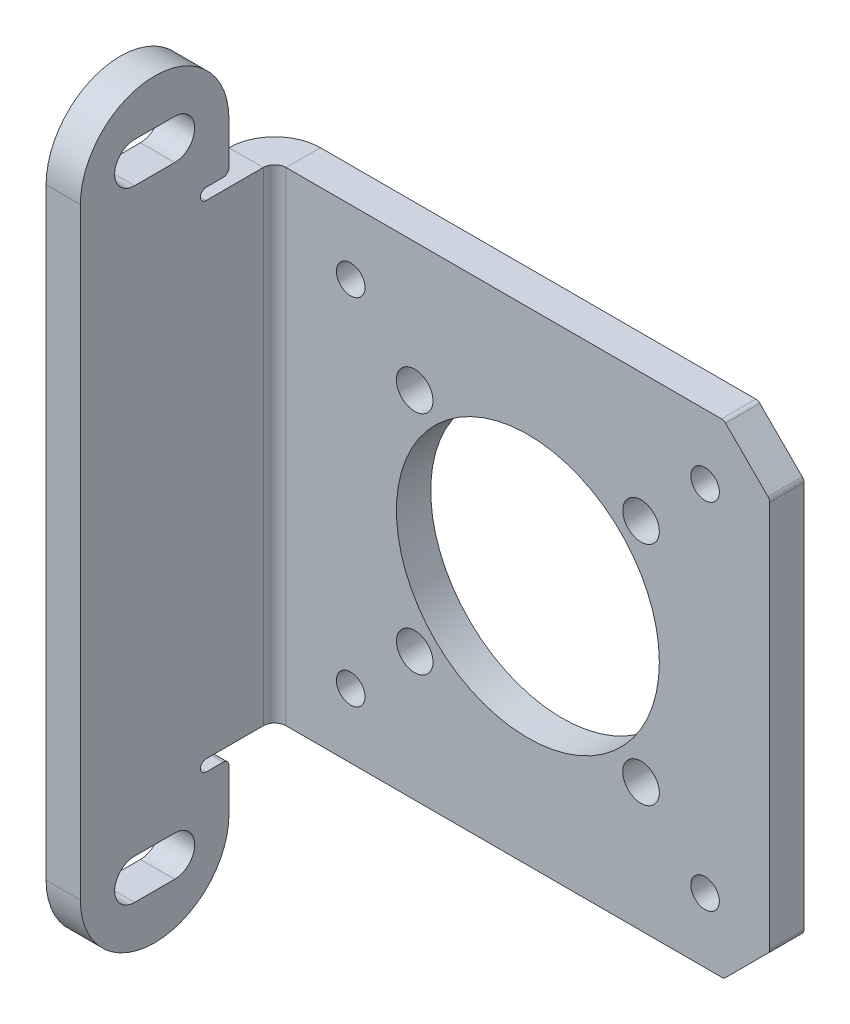
from build123d import *

# Parameters (mm, degrees)
CROQUIS1_W                       = 46.3
CROQUIS1_H                       = 42.3
CROQUIS1_R                       = 11.5
CROQUIS1_R_2                     = 1.25
BRIDA_BASE1_DEPTH                = 3
STRUCTURE_SUPORT_STRIP_W         = 14
STRUCTURE_SUPORT_STRIP_H         = 3
STRUCTURE_SUPORT_STRIP_CUT_DEPTH = 42.3
STRUCTURE_SUPORT_DEPTH           = 42.3
STRUCTURE_SUPORT_FLAT_DEPTH      = 3
CROQUIS13_R                      = 1.75
CORTAR_EXTRUIR2_DEPTH            = 57.94168596
DESDOBLAR2_DEPTH                 = 17
DESDOBLAR2_START                 = -3
DESDOBLAR2_2_DEPTH               = 3
DOBLAR2_START                    = -41.076990817
DOBLAR2_OUTLINE_W                = 57.8
DOBLAR2_OUTLINE_H                = 3
DOBLAR2_DEPTH                    = 16
DOBLAR2_START_2                  = -24.77248
DOBLAR2_2_DEPTH                  = 2.62248
DOBLAR2_START_3                  = -25.15
DOBLAR2_3_DEPTH                  = 4
DOBLAR2_START_4                  = -34
DOBLAR2_4_DEPTH                  = 68
CHAFL_N1_SIZE                    = 4
TALADRO_DE_MARGEN_PARA_M31_D     = 3.2
CORTAR_EXTRUIR6_REACH            = 58.942
REDONDEO2_R                      = 0.5


with BuildPart() as part:
    # Brida base1: sheet metal written as solids
    # Croquis1 → Brida base1 (new body)
    with BuildSketch(Plane.XY):
        with Locations((-2, 0)):
            Rectangle(CROQUIS1_W, CROQUIS1_H)
        Circle(CROQUIS1_R, mode=Mode.SUBTRACT)
        with Locations((-15.5, 15.5)):
            Circle(CROQUIS1_R_2, mode=Mode.SUBTRACT)
        with Locations((-15.5, -15.5)):
            Circle(CROQUIS1_R_2, mode=Mode.SUBTRACT)
        with Locations((15.5, -15.5)):
            Circle(CROQUIS1_R_2, mode=Mode.SUBTRACT)
        with Locations((15.5, 15.5)):
            Circle(CROQUIS1_R_2, mode=Mode.SUBTRACT)
    extrude(amount=-BRIDA_BASE1_DEPTH)

    # Structure Suport: sheet metal written as solids
    # Structure Suport strip (on a plane across the edge) → Structure Suport strip cut (cut)
    with BuildSketch(Plane(origin=(-25.15, 21.15, 0), x_dir=(1, 0, 0), z_dir=(0, -1, 0))):
        with Locations((-3, -1.5)):
            Rectangle(STRUCTURE_SUPORT_STRIP_W, STRUCTURE_SUPORT_STRIP_H)
    extrude(amount=STRUCTURE_SUPORT_STRIP_CUT_DEPTH, mode=Mode.SUBTRACT)

    # Structure Suport bend section (on a plane across the edge) → Structure Suport (add)
    with BuildSketch(Plane(origin=(-25.15, 21.15, 0), x_dir=(1, 0, 0), z_dir=(0, -1, 0))):
        with BuildLine():
            Line((0, 1), (3, 1))
            ThreePointArc((3, 1), (3.292893219, 0.292893219), (4, 0))
            Line((4, 0), (4, -3))
            ThreePointArc((4, -3), (1.171572875, -1.828427125), (0, 1))
        make_face()
    extrude(amount=STRUCTURE_SUPORT_DEPTH)

    # Structure Suport profile (on flange) → Structure Suport flat (add)
    with BuildSketch(Plane(origin=(-25.15, 0, 0), x_dir=(0, -1, 0), z_dir=(-1, 0, 0))):
        with BuildLine():
            ThreePointArc((-26.34, 17), (-32.84, 10.5), (-26.34, 4))
            Line((-26.34, 4), (-21.15, 4))
            Line((-21.15, 4), (-21.15, 1))
            Line((-21.15, 1), (21.15, 1))
            Line((21.15, 1), (21.15, 4))
            Line((21.15, 4), (26.34, 4))
            ThreePointArc((26.34, 4), (32.84, 10.5), (26.34, 17))
            Line((26.34, 17), (-26.34, 17))
        make_face()
    extrude(amount=-STRUCTURE_SUPORT_FLAT_DEPTH)

    # Croquis13 → Cortar-Extruir2 (cut, through all)
    with BuildSketch(Plane(origin=(-22.15, 0, 0), x_dir=(0, 0, -1), z_dir=(1, 0, 0))):
        with Locations((-10.5, 27.15)):
            Circle(CROQUIS13_R)
        with BuildLine():
            Line((-10.5, 28.9), (-12.25, 28.9))
            ThreePointArc((-12.25, 28.9), (-14, 27.15), (-12.25, 25.4))
            Line((-12.25, 25.4), (-10.5, 25.4))
            ThreePointArc((-10.5, 25.4), (-12.25, 27.15), (-10.5, 28.9))
        make_face()
        with BuildLine():
            Line((-8.75, 28.9), (-10.5, 28.9))
            ThreePointArc((-10.5, 28.9), (-9.262563133, 28.387436867), (-8.75, 27.15))
            ThreePointArc((-8.75, 27.15), (-9.262563133, 25.912563133), (-10.5, 25.4))
            Line((-10.5, 25.4), (-8.75, 25.4))
            ThreePointArc((-8.75, 25.4), (-7, 27.15), (-8.75, 28.9))
        make_face()
        with Locations((-10.5, -27.15)):
            Circle(CROQUIS13_R)
        with BuildLine():
            Line((-10.5, -25.4), (-12.25, -25.4))
            ThreePointArc((-12.25, -25.4), (-14, -27.15), (-12.25, -28.9))
            Line((-12.25, -28.9), (-10.5, -28.9))
            ThreePointArc((-10.5, -28.9), (-12.25, -27.15), (-10.5, -25.4))
        make_face()
        with BuildLine():
            Line((-8.75, -25.4), (-10.5, -25.4))
            ThreePointArc((-10.5, -25.4), (-9.262563133, -25.912563133), (-8.75, -27.15))
            ThreePointArc((-8.75, -27.15), (-9.262563133, -28.387436867), (-10.5, -28.9))
            Line((-10.5, -28.9), (-8.75, -28.9))
            ThreePointArc((-8.75, -28.9), (-7, -27.15), (-8.75, -25.4))
        make_face()
    extrude(amount=-CORTAR_EXTRUIR2_DEPTH, mode=Mode.SUBTRACT)

    # Desdoblar2: read off the stored shape, not the designer's step
    # Desdoblar2 outline → Desdoblar2 (cut)
    with BuildSketch(Plane.XY):
        Polygon((-25.15, -34), (-22.15, -34), (-22.15, -21.15), (-20, -21.15), (-20, 21.15), (-22.15, 21.15), (-22.15, 34), (-25.15, 34), align=None)
    extrude(amount=DESDOBLAR2_DEPTH, mode=Mode.SUBTRACT)

    # Desdoblar2 2 outline → Desdoblar2 2 (add)
    with BuildSketch(Plane.XY.offset(DESDOBLAR2_START)):
        with BuildLine():
            Line((-28.076990817, 21.15), (-28.076990817, 26.34))
            ThreePointArc((-28.076990817, 26.34), (-34.576990817, 32.84), (-41.076990817, 26.34))
            Line((-41.076990817, 26.34), (-41.076990817, -26.34))
            ThreePointArc((-41.076990817, -26.34), (-34.576990817, -32.84), (-28.076990817, -26.34))
            Line((-28.076990817, -26.34), (-28.076990817, -21.15))
            Line((-28.076990817, -21.15), (-20, -21.15))
            Line((-20, -21.15), (-20, 21.15))
            Line((-20, 21.15), (-28.076990817, 21.15))
        make_face()
        with BuildLine():
            Line((-36.326990817, -25.4), (-32.826990817, -25.4))
            ThreePointArc((-32.826990817, -25.4), (-31.076990817, -27.15), (-32.826990817, -28.9))
            Line((-32.826990817, -28.9), (-36.326990817, -28.9))
            ThreePointArc((-36.326990817, -28.9), (-38.076990817, -27.15), (-36.326990817, -25.4))
        make_face(mode=Mode.SUBTRACT)
        with BuildLine():
            Line((-32.826990817, 25.4), (-36.326990817, 25.4))
            ThreePointArc((-36.326990817, 25.4), (-38.076990817, 27.15), (-36.326990817, 28.9))
            Line((-36.326990817, 28.9), (-32.826990817, 28.9))
            ThreePointArc((-32.826990817, 28.9), (-31.076990817, 27.15), (-32.826990817, 25.4))
        make_face(mode=Mode.SUBTRACT)
    extrude(amount=DESDOBLAR2_2_DEPTH)

    # Doblar2: read off the stored shape, not the designer's step
    # Doblar2 outline → Doblar2 (cut)
    with BuildSketch(Plane.YZ.offset(DOBLAR2_START)):
        with Locations((0, -1.5)):
            Rectangle(DOBLAR2_OUTLINE_W, DOBLAR2_OUTLINE_H)
    extrude(amount=DOBLAR2_DEPTH, mode=Mode.SUBTRACT)

    # Doblar2 2 outline → Doblar2 2 (add)
    with BuildSketch(Plane.YZ.offset(DOBLAR2_START_2)):
        with BuildLine():
            Line((21.15, 0), (21.15, 4))
            Line((21.15, 4), (26.34, 4))
            ThreePointArc((26.34, 4), (32.84, 10.5), (26.34, 17))
            Line((26.34, 17), (-26.34, 17))
            ThreePointArc((-26.34, 17), (-32.84, 10.5), (-26.34, 4))
            Line((-26.34, 4), (-21.15, 4))
            Line((-21.15, 4), (-21.15, 0))
            Line((-21.15, 0), (21.15, 0))
        make_face()
        with BuildLine():
            ThreePointArc((-28.9, 12.25), (-27.15, 14), (-25.4, 12.25))
            Line((-25.4, 12.25), (-25.4, 8.75))
            ThreePointArc((-25.4, 8.75), (-27.15, 7), (-28.9, 8.75))
            Line((-28.9, 8.75), (-28.9, 12.25))
        make_face(mode=Mode.SUBTRACT)
        with BuildLine():
            ThreePointArc((25.4, 12.25), (27.15, 14), (28.9, 12.25))
            Line((28.9, 12.25), (28.9, 8.75))
            ThreePointArc((28.9, 8.75), (27.15, 7), (25.4, 8.75))
            Line((25.4, 8.75), (25.4, 12.25))
        make_face(mode=Mode.SUBTRACT)
    extrude(amount=DOBLAR2_2_DEPTH)

    # Doblar2 3 outline → Doblar2 3 (add)
    with BuildSketch(Plane.YZ.offset(DOBLAR2_START_3)):
        with BuildLine():
            Line((21.15, 0), (21.15, 4))
            Line((21.15, 4), (26.34, 4))
            ThreePointArc((26.34, 4), (32.84, 10.5), (26.34, 17))
            Line((26.34, 17), (-26.34, 17))
            ThreePointArc((-26.34, 17), (-32.84, 10.5), (-26.34, 4))
            Line((-26.34, 4), (-21.15, 4))
            Line((-21.15, 4), (-21.15, 0))
            Line((-21.15, 0), (21.15, 0))
        make_face()
        with BuildLine():
            ThreePointArc((-28.9, 12.25), (-27.15, 14), (-25.4, 12.25))
            Line((-25.4, 12.25), (-25.4, 8.75))
            ThreePointArc((-25.4, 8.75), (-27.15, 7), (-28.9, 8.75))
            Line((-28.9, 8.75), (-28.9, 12.25))
        make_face(mode=Mode.SUBTRACT)
        with BuildLine():
            ThreePointArc((25.4, 12.25), (27.15, 14), (28.9, 12.25))
            Line((28.9, 12.25), (28.9, 8.75))
            ThreePointArc((28.9, 8.75), (27.15, 7), (25.4, 8.75))
            Line((25.4, 8.75), (25.4, 12.25))
        make_face(mode=Mode.SUBTRACT)
    extrude(amount=DOBLAR2_3_DEPTH)

    # Doblar2 4 outline → Doblar2 4 (cut)
    with BuildSketch(Plane(origin=(0, 0, 0), x_dir=(1, 0, 0), z_dir=(0, 1, 0)).offset(DOBLAR2_START_4)):
        with BuildLine():
            ThreePointArc((-21.15, 0), (-21.857106781, -0.292893219), (-22.15, -1))
            Line((-22.15, -1), (-22.15, -17))
            Line((-22.15, -17), (-21.15, -17))
            Line((-21.15, -17), (-21.15, 0))
        make_face()
        with BuildLine():
            Line((-25.15, -17), (-25.15, -1))
            ThreePointArc((-25.15, -1), (-23.978427125, 1.828427125), (-21.15, 3))
            Line((-21.15, 3), (-20, 3))
            Line((-20, 3), (-20, 5))
            Line((-20, 5), (-42, 5))
            Line((-42, 5), (-42, -17))
            Line((-42, -17), (-25.15, -17))
        make_face()
    extrude(amount=DOBLAR2_4_DEPTH, mode=Mode.SUBTRACT)

    # Chaflán1
    chafl_n1_edges = [part.edges().sort_by_distance(p)[0] for p in [
        (21.15, 21.15, -1.5),
        (21.15, -21.15, -1.5),
    ]]
    chamfer(chafl_n1_edges, length=CHAFL_N1_SIZE)

    # Taladro de margen para M31 (through all)
    with Locations(Plane(origin=(0, 0, -3), x_dir=(-1, 0, 0), z_dir=(0, 0, -1))):
        with Locations((9.899494937, -9.899494937), (-9.899494937, -9.899494937), (-9.899494937, 9.899494937), (9.899494937, 9.899494937)):
            Hole(TALADRO_DE_MARGEN_PARA_M31_D / 2)

    # Croquis34 → Cortar-Extruir6 (cut, up to next)
    with BuildSketch(Plane(origin=(-22.15, 0, 0), x_dir=(0, 0, -1), z_dir=(1, 0, 0)), mode=Mode.PRIVATE) as cortar_extruir6_sk1:
        with BuildLine():
            Line((-6, 21.15), (-4, 21.15))
            Line((-4, 21.15), (-4, 22.15))
            Line((-4, 22.15), (-6, 22.15))
            ThreePointArc((-6, 22.15), (-6.5, 21.65), (-6, 21.15))
        make_face()
    cortar_extruir6_tool1 = extrude(cortar_extruir6_sk1.sketch, amount=-CORTAR_EXTRUIR6_REACH, mode=Mode.PRIVATE) & part.part
    # Croquis34 → Cortar-Extruir6 (cut, up to next)
    with BuildSketch(Plane(origin=(-22.15, 0, 0), x_dir=(0, 0, -1), z_dir=(1, 0, 0)), mode=Mode.PRIVATE) as cortar_extruir6_sk2:
        with BuildLine():
            Line((-4, -22.15), (-6, -22.15))
            ThreePointArc((-6, -22.15), (-6.5, -21.65), (-6, -21.15))
            Line((-6, -21.15), (-4, -21.15))
            Line((-4, -21.15), (-4, -22.15))
        make_face()
    cortar_extruir6_tool2 = extrude(cortar_extruir6_sk2.sketch, amount=-CORTAR_EXTRUIR6_REACH, mode=Mode.PRIVATE) & part.part
    add(cortar_extruir6_tool1.solids().sort_by_distance((-22.15, 21.65, 5.198952))[0], mode=Mode.SUBTRACT)
    add(cortar_extruir6_tool2.solids().sort_by_distance((-22.15, -21.65, 5.198952))[0], mode=Mode.SUBTRACT)

    # Redondeo2
    redondeo2_edges = [part.edges().sort_by_distance(p)[0] for p in [
        (21.15, -17.15, -1.5),
        (21.15, 17.15, -1.5),
        (17.15, 21.15, -1.5),
        (17.15, -21.15, -1.5),
        (-23.65, -22.15, 4),
        (-23.65, 22.15, 4),
    ]]
    fillet(redondeo2_edges, radius=REDONDEO2_R)


solid = part.part
